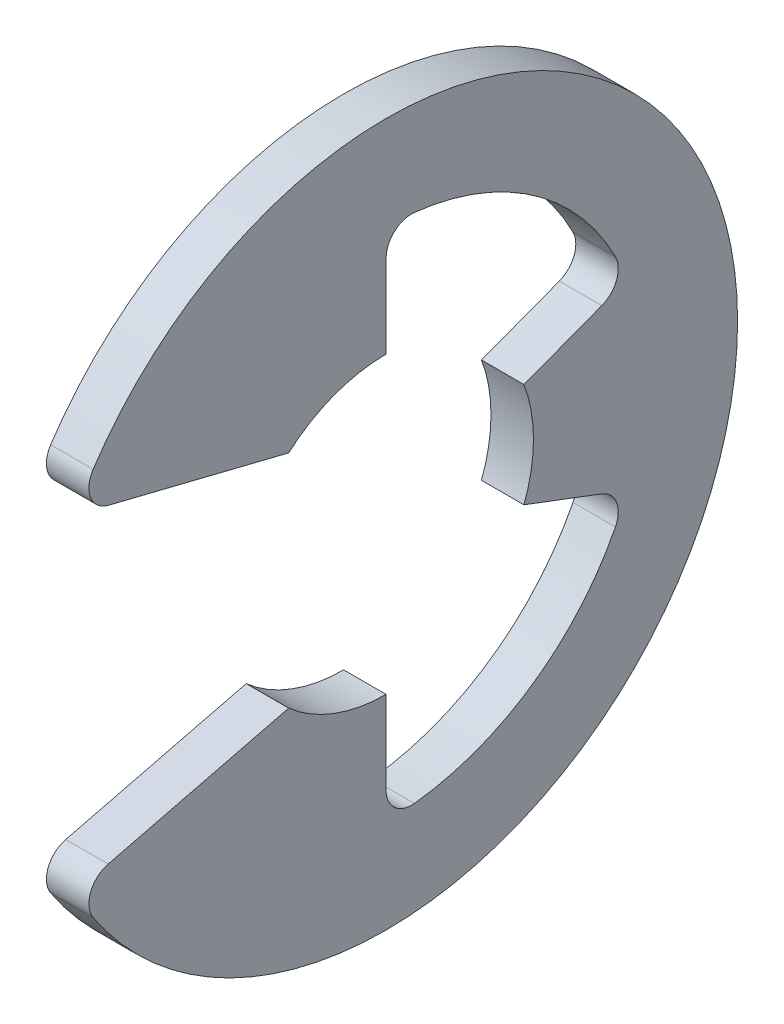
from build123d import *

# Parameters (mm, degrees)
EXTRUDE1_DEPTH = 0.55
FILLET1_R      = 0.66


with BuildPart() as part:
    # Sketch1 → Extrude1 (new, symmetric)
    with BuildSketch(Plane(origin=(0, 0, 0), x_dir=(0, 0, -1), z_dir=(1, 0, 0))):
        with BuildLine():
            Line((-8.05474673, -4.234507659), (-2.523385313, -2.86125))
            ThreePointArc((-2.523385313, -2.86125), (-1.348806185, -3.568605733), (0, -3.815))
            Line((0, -3.815), (0, -6.665806452))
            ThreePointArc((0, -6.665806452), (3.789693025, -5.483721585), (6.235290987, -2.356718472))
            Line((6.235290987, -2.356718472), (3.568605733, -1.348806185))
            ThreePointArc((3.568605733, -1.348806185), (3.815, 0), (3.568605733, 1.348806185))
            Line((3.568605733, 1.348806185), (6.235290987, 2.356718472))
            ThreePointArc((6.235290987, 2.356718472), (3.789693025, 5.483721585), (0, 6.665806452))
            Line((0, 6.665806452), (0, 3.815))
            ThreePointArc((0, 3.815), (-1.348806185, 3.568605733), (-2.523385313, 2.86125))
            Line((-2.523385313, 2.86125), (-8.05474673, 4.234507659))
            ThreePointArc((-8.05474673, 4.234507659), (9.1, 0), (-8.05474673, -4.234507659))
        make_face()
    extrude(amount=EXTRUDE1_DEPTH, both=True)

    # Fillet1
    fillet1_edges = [part.edges().sort_by_distance(p)[0] for p in [
        (0, -6.665806452, 0),
        (0, 6.665806452, 0),
        (0, -4.234507659, 8.05474673),
        (0, 4.234507659, 8.05474673),
        (0, -2.356718472, -6.235290987),
        (0, 2.356718472, -6.235290987),
    ]]
    fillet(fillet1_edges, radius=FILLET1_R)


solid = part.part
